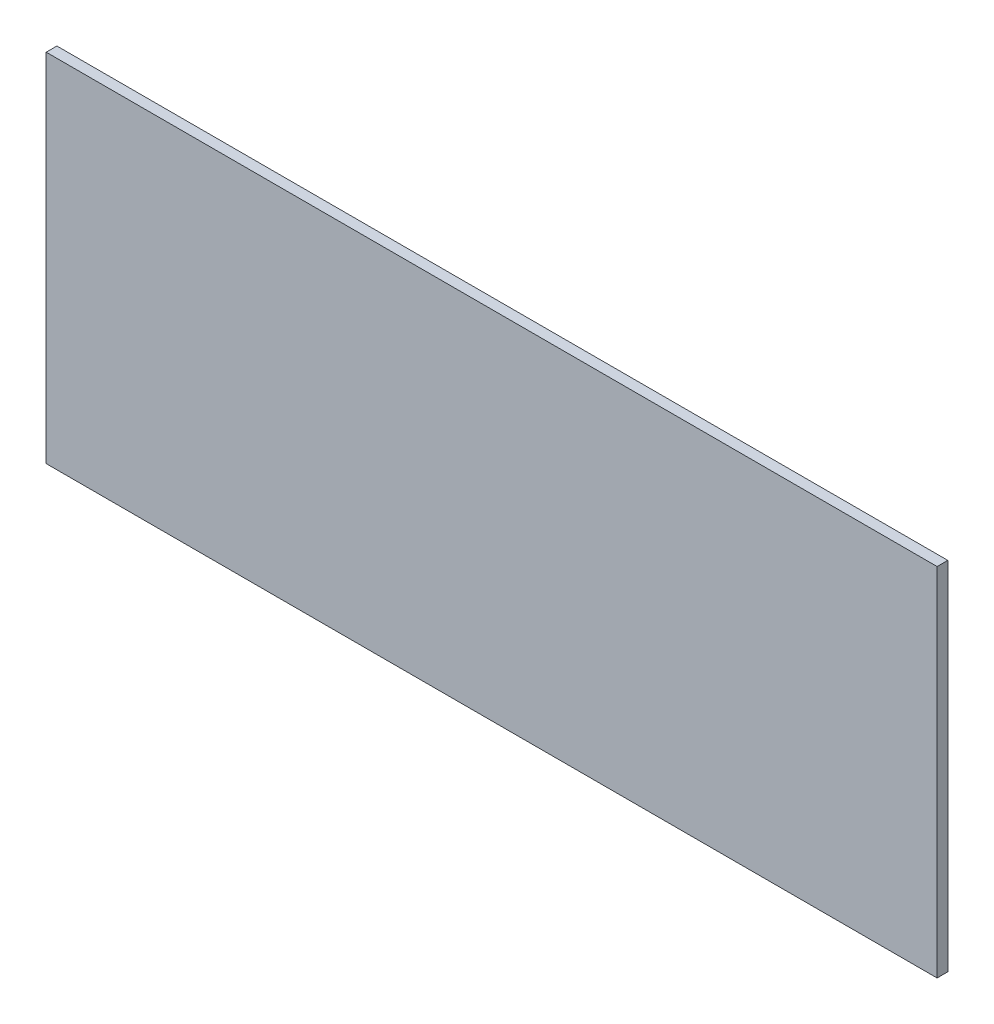
from build123d import *

# Parameters (mm, degrees)
IZIM1_W            = 1000
IZIM1_H            = 400
TABAN_FLAN_1_DEPTH = 12


# Sheet-metal steps are written as plain solids
with BuildPart() as part:
    # Çizim1 → Taban-Flanş1 (new body)
    with BuildSketch(Plane.XY):
        with Locations((500, -200)):
            Rectangle(IZIM1_W, IZIM1_H)
    extrude(amount=-TABAN_FLAN_1_DEPTH)


solid = part.part
